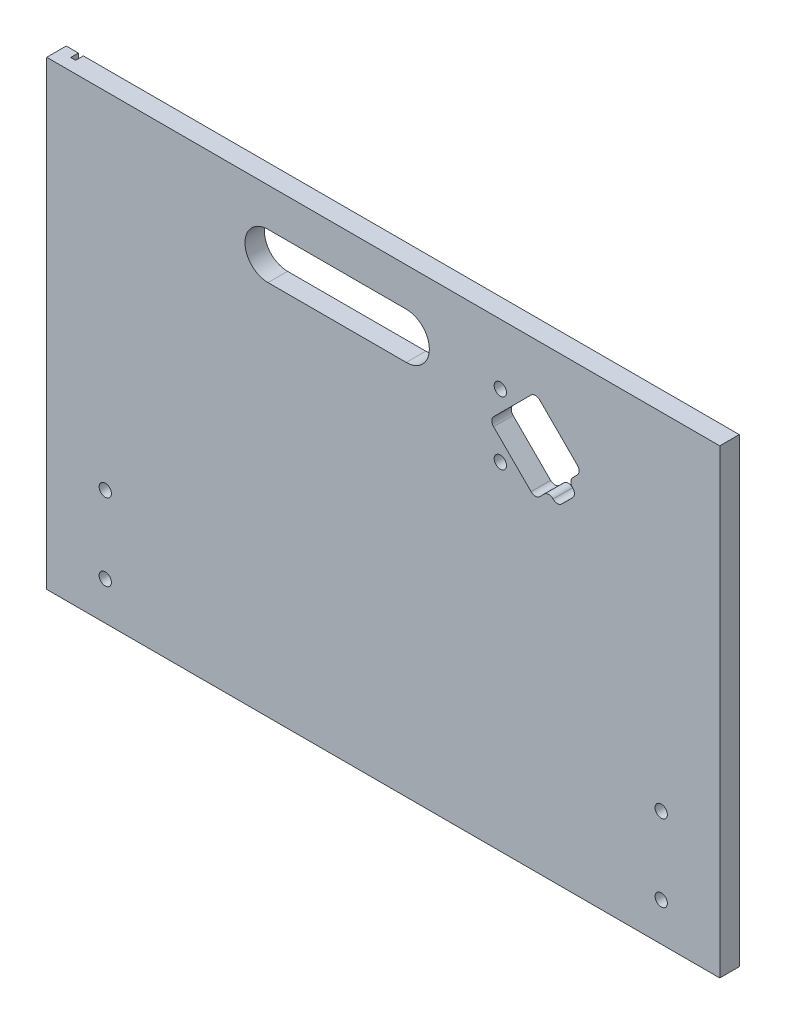
from build123d import *

# Parameters (mm, degrees)
SKETCH1_W           = 438.1
SKETCH1_H           = 300
BOSS_EXTRUDE1_DEPTH = 12.7
CUT_EXTRUDE1_REACH  = 267.79
SKETCH2_R           = 4
FILLET1_R           = 4
SKETCH3_W           = 3.175
SKETCH3_H           = 205
CUT_EXTRUDE2_DEPTH  = 5
CUT_EXTRUDE3_REACH  = 267.79
SKETCH4_R           = 4
CUT_EXTRUDE4_REACH  = 267.79


with BuildPart() as part:
    # Sketch1 → Boss-Extrude1 (new body)
    with BuildSketch(Plane.XY):
        Rectangle(SKETCH1_W, SKETCH1_H)
    extrude(amount=BOSS_EXTRUDE1_DEPTH)

    # Sketch2 → Cut-Extrude1 (cut, up to next)
    with BuildSketch(Plane.XY.offset(12.7), mode=Mode.PRIVATE) as cut_extrude1_sk1:
        with Locations((76.214870385, 110.590065585)):
            Circle(SKETCH2_R)
    cut_extrude1_tool1 = extrude(cut_extrude1_sk1.sketch, amount=-CUT_EXTRUDE1_REACH, mode=Mode.PRIVATE) & part.part
    # Sketch2 → Cut-Extrude1 (cut, up to next)
    with BuildSketch(Plane.XY.offset(12.7), mode=Mode.PRIVATE) as cut_extrude1_sk2:
        with Locations((76.214870385, 69.409934415)):
            Circle(SKETCH2_R)
    cut_extrude1_tool2 = extrude(cut_extrude1_sk2.sketch, amount=-CUT_EXTRUDE1_REACH, mode=Mode.PRIVATE) & part.part
    # Sketch2 → Cut-Extrude1 (cut, up to next)
    with BuildSketch(Plane.XY.offset(12.7), mode=Mode.PRIVATE) as cut_extrude1_sk3:
        Polygon((99.05, 120.0520382), (68.9979618, 90), (99.05, 59.9479618), (107.71205807, 68.610019869), (113.368912319, 62.95316562), (126.09683438, 75.681087681), (120.439980131, 81.33794193), (129.1020382, 90), align=None)
    cut_extrude1_tool3 = extrude(cut_extrude1_sk3.sketch, amount=-CUT_EXTRUDE1_REACH, mode=Mode.PRIVATE) & part.part
    add(cut_extrude1_tool1.solids().sort_by_distance((76.21487, 110.590066, 12.7))[0], mode=Mode.SUBTRACT)
    add(cut_extrude1_tool2.solids().sort_by_distance((76.21487, 69.409934, 12.7))[0], mode=Mode.SUBTRACT)
    add(cut_extrude1_tool3.solids().sort_by_distance((100.368313, 88.681687, 12.7))[0], mode=Mode.SUBTRACT)

    # Fillet1
    fillet1_edges = [part.edges().sort_by_distance(p)[0] for p in [
        (99.05, 120.0520382, 6.35),
        (68.9979618, 90, 6.35),
        (120.439980131, 81.33794193, 6.35),
        (126.09683438, 75.681087681, 6.35),
        (113.368912319, 62.95316562, 6.35),
        (107.71205807, 68.610019869, 6.35),
        (99.05, 59.9479618, 6.35),
        (129.1020382, 90, 6.35),
    ]]
    fillet(fillet1_edges, radius=FILLET1_R - 0.0001)  # a hair under: the kernel refuses the full size

    # Sketch3 → Cut-Extrude2 (cut)
    with BuildSketch(Plane(origin=(0, 0, 0), x_dir=(-1, 0, 0), z_dir=(0, 0, -1))):
        with Locations((209.525, 47.5)):
            Rectangle(SKETCH3_W, SKETCH3_H)
    extrude(amount=-CUT_EXTRUDE2_DEPTH, mode=Mode.SUBTRACT)

    # Sketch4 → Cut-Extrude3 (cut, up to next)
    with BuildSketch(Plane(origin=(0, 0, 0), x_dir=(-1, 0, 0), z_dir=(0, 0, -1)), mode=Mode.PRIVATE) as cut_extrude3_sk1:
        with Locations((-180.95, -75)):
            Circle(SKETCH4_R)
    cut_extrude3_tool1 = extrude(cut_extrude3_sk1.sketch, amount=-CUT_EXTRUDE3_REACH, mode=Mode.PRIVATE) & part.part
    # Sketch4 → Cut-Extrude3 (cut, up to next)
    with BuildSketch(Plane(origin=(0, 0, 0), x_dir=(-1, 0, 0), z_dir=(0, 0, -1)), mode=Mode.PRIVATE) as cut_extrude3_sk2:
        with Locations(Location((-180.95, -125, 0), (0, 0, 180))):
            Circle(SKETCH4_R)
    cut_extrude3_tool2 = extrude(cut_extrude3_sk2.sketch, amount=-CUT_EXTRUDE3_REACH, mode=Mode.PRIVATE) & part.part
    # Sketch4 → Cut-Extrude3 (cut, up to next)
    with BuildSketch(Plane(origin=(0, 0, 0), x_dir=(-1, 0, 0), z_dir=(0, 0, -1)), mode=Mode.PRIVATE) as cut_extrude3_sk3:
        with Locations((180.95, -125)):
            Circle(SKETCH4_R)
    cut_extrude3_tool3 = extrude(cut_extrude3_sk3.sketch, amount=-CUT_EXTRUDE3_REACH, mode=Mode.PRIVATE) & part.part
    # Sketch4 → Cut-Extrude3 (cut, up to next)
    with BuildSketch(Plane(origin=(0, 0, 0), x_dir=(-1, 0, 0), z_dir=(0, 0, -1)), mode=Mode.PRIVATE) as cut_extrude3_sk4:
        with Locations(Location((180.95, -75, 0), (0, 0, 180))):
            Circle(SKETCH4_R)
    cut_extrude3_tool4 = extrude(cut_extrude3_sk4.sketch, amount=-CUT_EXTRUDE3_REACH, mode=Mode.PRIVATE) & part.part
    add(cut_extrude3_tool1.solids().sort_by_distance((180.95, -75, 0))[0], mode=Mode.SUBTRACT)
    add(cut_extrude3_tool2.solids().sort_by_distance((180.95, -125, 0))[0], mode=Mode.SUBTRACT)
    add(cut_extrude3_tool3.solids().sort_by_distance((-180.95, -125, 0))[0], mode=Mode.SUBTRACT)
    add(cut_extrude3_tool4.solids().sort_by_distance((-180.95, -75, 0))[0], mode=Mode.SUBTRACT)

    # Sketch5 → Cut-Extrude4 (cut, up to next)
    with BuildSketch(Plane.XY.offset(12.7), mode=Mode.PRIVATE) as cut_extrude4_sk1:
        with BuildLine():
            Line((15, 95), (-75, 95))
            ThreePointArc((-75, 95), (-90, 110), (-75, 125))
            Line((-75, 125), (15, 125))
            ThreePointArc((15, 125), (30, 110), (15, 95))
        make_face()
    cut_extrude4_tool1 = extrude(cut_extrude4_sk1.sketch, amount=-CUT_EXTRUDE4_REACH, mode=Mode.PRIVATE) & part.part
    add(cut_extrude4_tool1.solids().sort_by_distance((-30, 110, 12.7))[0], mode=Mode.SUBTRACT)


solid = part.part
